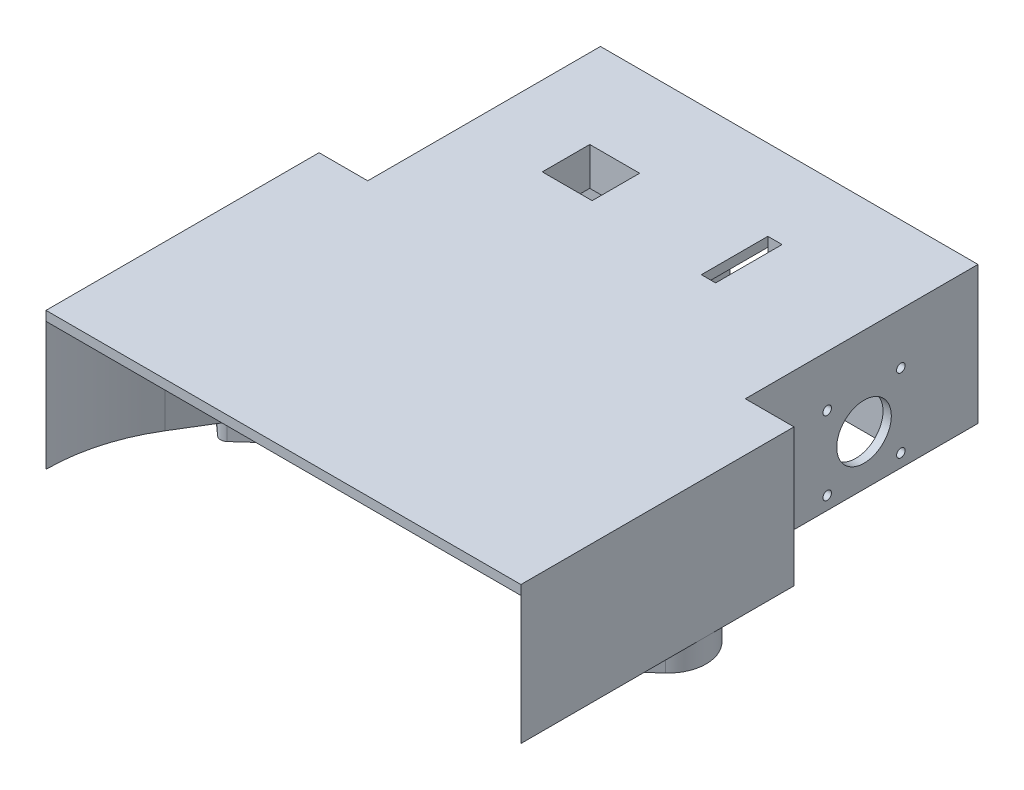
from build123d import *

# Parameters (mm, degrees)
SKETCH_1_W           = 200
SKETCH_1_H           = 213
EXTRUDE_1_DEPTH      = 4
EXTRUDE_2_DEPTH      = 54
CUT_EXTRUDE_2_DEPTH  = 298.880848663
CUT_EXTRUDE_3_DEPTH  = 42
SKETCH_7_R           = 1.8
SKETCH_7_R_2         = 11.5
CUT_EXTRUDE_4_DEPTH  = 282.53330176
MIRROR_START         = 176
MIRROR_1_OUTLINE_R   = 1.8
MIRROR_1_OUTLINE_R_2 = 11.5
MIRROR_1_DEPTH       = 3.5
SKETCH_8_W           = 27
SKETCH_8_H           = 28
CUT_EXTRUDE_5_DEPTH  = 6
SKETCH_9_W           = 27
SKETCH_9_H           = 20
CUT_EXTRUDE_6_DEPTH  = 21
CUT_EXTRUDE_START    = -54
CUT_EXTRUDE_7_DEPTH  = 54
SKETCH_12_R          = 2
EXTRUDE_3_DEPTH      = 10
SKETCH_14_W          = 21
SKETCH_14_H          = 20
CUT_EXTRUDE_8_DEPTH  = 297.770955452
SKETCH_15_W          = 6
SKETCH_15_H          = 28
CUT_EXTRUDE_9_DEPTH  = 297.770955452


# Read off the part's stored shape, not the designer's step: 镜向1
with BuildPart() as part:
    # 草图1 → 凸台-拉伸1 (new body)
    with BuildSketch(Plane(origin=(0, 0, 0), x_dir=(1, 0, 0), z_dir=(0, 1, 0))):
        with Locations((100, 106.5)):
            Rectangle(SKETCH_1_W, SKETCH_1_H)
    extrude(amount=EXTRUDE_1_DEPTH)

    # 草图1<4> → 凸台-拉伸2 (add)
    with BuildSketch(Plane(origin=(0, 0, 0), x_dir=(1, 0, 0), z_dir=(0, 1, 0))):
        with BuildLine():
            Line((0, 213), (0, 0))
            ThreePointArc((0, 0), (21.966991411, 53.033008589), (75, 75))
            Line((75, 75), (75, 213))
            Line((75, 213), (0, 213))
        make_face()
        with BuildLine():
            Line((125, 213), (125, 75))
            ThreePointArc((125, 75), (178.033008589, 53.033008589), (200, 0))
            Line((200, 0), (200, 213))
            Line((200, 213), (125, 213))
        make_face()
    extrude(amount=-EXTRUDE_2_DEPTH)

    # 草图3 → 切除-拉伸2 (cut, through all)
    with BuildSketch(Plane.XZ.offset(54)):
        Polygon((20.5, -186), (20.5, -165), (20.5, -144), (20.5, -115), (0, -115), (0, -213), (20.5, -213), align=None)
        Polygon((179.5, -115), (200, -115), (200, -213), (179.5, -213), (179.5, -165), align=None)
    extrude(amount=-CUT_EXTRUDE_2_DEPTH, mode=Mode.SUBTRACT)

    # 草图5 → 切除-拉伸3 (cut)
    with BuildSketch(Plane.XZ.offset(54)):
        Polygon((176, -164), (176, -144), (125, -144), (125, -186), (176, -186), align=None)
        Polygon((24, -164), (24, -144), (75, -144), (75, -186), (24, -186), align=None)
    extrude(amount=-CUT_EXTRUDE_3_DEPTH, mode=Mode.SUBTRACT)

    # 草图7 → 切除-拉伸4 (cut, through all)
    with BuildSketch(Plane(origin=(24, 0, 0), x_dir=(0, 0, -1), z_dir=(1, 0, 0))):
        with Locations((180.5, -17.5)):
            Circle(SKETCH_7_R)
        with Locations((149.5, -17.5)):
            Circle(SKETCH_7_R)
        with Locations((165, -33)):
            Circle(SKETCH_7_R_2)
        with Locations((180.5, -48.5)):
            Circle(SKETCH_7_R)
        with Locations((149.5, -48.5)):
            Circle(SKETCH_7_R)
    extrude(amount=-CUT_EXTRUDE_4_DEPTH, mode=Mode.SUBTRACT)

    # 镜向1 outline → 镜向1 (cut)
    with BuildSketch(Plane.YZ.offset(MIRROR_START)):
        with Locations((-17.5, -180.5)):
            Circle(MIRROR_1_OUTLINE_R)
        with Locations((-17.5, -149.5)):
            Circle(MIRROR_1_OUTLINE_R)
        with Locations((-33, -165)):
            Circle(MIRROR_1_OUTLINE_R_2)
        with Locations((-48.5, -180.5)):
            Circle(MIRROR_1_OUTLINE_R)
        with Locations((-48.5, -149.5)):
            Circle(MIRROR_1_OUTLINE_R)
    extrude(amount=MIRROR_1_DEPTH, mode=Mode.SUBTRACT)

    # 草图8 → 切除-拉伸5 (cut)
    with BuildSketch(Plane(origin=(75, 0, 0), x_dir=(0, 0, -1), z_dir=(1, 0, 0))):
        with Locations((199.5, -33)):
            Rectangle(SKETCH_8_W, SKETCH_8_H)
    extrude(amount=-CUT_EXTRUDE_5_DEPTH, mode=Mode.SUBTRACT)

    # 草图9 → 切除-拉伸6 (cut)
    with BuildSketch(Plane.ZY.offset(-125)):
        with Locations((-199.5, -33)):
            Rectangle(SKETCH_9_W, SKETCH_9_H)
    extrude(amount=-CUT_EXTRUDE_6_DEPTH, mode=Mode.SUBTRACT)

    # 草图11 → 切除-拉伸7 (cut)
    with BuildSketch(Plane.XZ.offset(54).offset(CUT_EXTRUDE_START)):
        with BuildLine():
            Line((29.658534166, -69.684244774), (10.975621098, -39.0625))
            ThreePointArc((10.975621098, -39.0625), (38.289562111, -65.401404801), (75, -75))
            Line((75, -75), (75, -144))
            ThreePointArc((75, -144), (37.483837038, -124.777752739), (31.171635941, -83.099060455))
            ThreePointArc((31.171635941, -83.099060455), (31.899182276, -76.224256342), (29.658534166, -69.684244774))
        make_face()
        with BuildLine():
            Line((125, -144), (125, -75))
            ThreePointArc((125, -75), (161.710437889, -65.401404801), (189.024378902, -39.0625))
            Line((189.024378902, -39.0625), (170.341465834, -69.684244774))
            ThreePointArc((170.341465834, -69.684244774), (168.100817724, -76.224256342), (168.828364059, -83.099060455))
            ThreePointArc((168.828364059, -83.099060455), (162.516162962, -124.777752739), (125, -144))
        make_face()
    extrude(amount=CUT_EXTRUDE_7_DEPTH, mode=Mode.SUBTRACT)

    # 草图12 → 凸台-拉伸3 (add)
    # profile 1 of 2: a face of its own
    with BuildSketch(Plane.XZ.offset(54)):
        with BuildLine():
            Line((18.008349917, -58.289006678), (26.711199556, -66.131863821))
            ThreePointArc((26.711199556, -66.131863821), (32, -78.017578107), (26.711199556, -89.903292393))
            Line((26.711199556, -89.903292393), (18.008349917, -97.746149535))
            ThreePointArc((18.008349917, -97.746149535), (16, -98.517578107), (13.991650083, -97.746149535))
            Line((13.991650083, -97.746149535), (5.288800444, -89.903292393))
            ThreePointArc((5.288800444, -89.903292393), (0, -78.017578107), (5.288800444, -66.131863821))
            Line((5.288800444, -66.131863821), (13.991650083, -58.289006678))
            ThreePointArc((13.991650083, -58.289006678), (16, -57.517578107), (18.008349917, -58.289006678))
        make_face()
        with Locations(Location((16, -60.517578107, 0), (0, 0, 270))):
            Circle(SKETCH_12_R, mode=Mode.SUBTRACT)
        with Locations(Location((16, -95.517578107, 0), (0, 0, 90))):
            Circle(SKETCH_12_R, mode=Mode.SUBTRACT)
    # profile 2 of 2: a face of its own
    with BuildSketch(Plane.XZ.offset(54)):
        with BuildLine():
            Line((186.008349917, -97.746149535), (194.711199556, -89.903292393))
            ThreePointArc((194.711199556, -89.903292393), (200, -78.017578107), (194.711199556, -66.131863821))
            Line((194.711199556, -66.131863821), (186.008349917, -58.289006678))
            ThreePointArc((186.008349917, -58.289006678), (184, -57.517578107), (181.991650083, -58.289006678))
            Line((181.991650083, -58.289006678), (173.288800444, -66.131863821))
            ThreePointArc((173.288800444, -66.131863821), (168, -78.017578107), (173.288800444, -89.903292393))
            Line((173.288800444, -89.903292393), (181.991650083, -97.746149535))
            ThreePointArc((181.991650083, -97.746149535), (184, -98.517578107), (186.008349917, -97.746149535))
        make_face()
        with Locations(Location((184, -95.517578107, 0), (0, 0, 270))):
            Circle(SKETCH_12_R, mode=Mode.SUBTRACT)
        with Locations(Location((184, -60.517578107, 0), (0, 0, 90))):
            Circle(SKETCH_12_R, mode=Mode.SUBTRACT)
    extrude(amount=EXTRUDE_3_DEPTH)

    # 草图14 → 切除-拉伸8 (cut, through all)
    with BuildSketch(Plane.XZ.offset(12)):
        with Locations((64.5, -165)):
            Rectangle(SKETCH_14_W, SKETCH_14_H)
    extrude(amount=-CUT_EXTRUDE_8_DEPTH, mode=Mode.SUBTRACT)

    # 草图15 → 切除-拉伸9 (cut, through all)
    with BuildSketch(Plane.XZ.offset(12)):
        with Locations((128, -165)):
            Rectangle(SKETCH_15_W, SKETCH_15_H)
    extrude(amount=-CUT_EXTRUDE_9_DEPTH, mode=Mode.SUBTRACT)


solid = part.part
